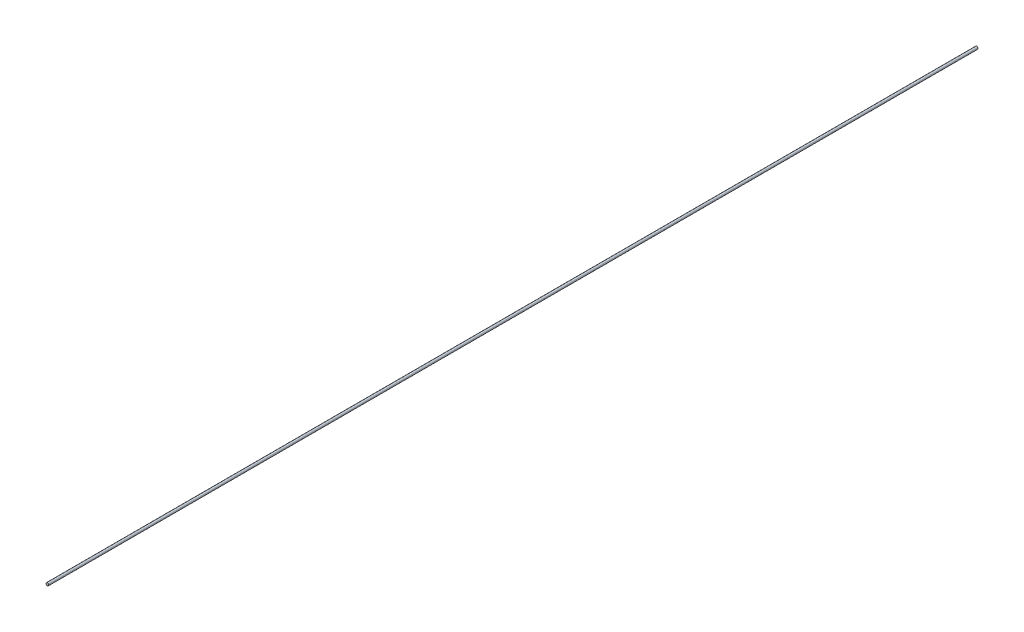
from build123d import *

# Parameters (mm, degrees)
SKETCH1_W = 1.27
SKETCH1_H = 889


with BuildPart() as part:
    # Sketch1 → Revolve-Thin1 (revolve)
    with BuildSketch(Plane(origin=(0, 0, 0), x_dir=(1, 0, 0), z_dir=(0, 1, 0))):
        with Locations((-2.378791677, 357.943903032)):
            Rectangle(SKETCH1_W, SKETCH1_H)
    revolve(axis=Axis((-3.013791677, 0, -802.443903032), (0, 0, 1)))


solid = part.part
